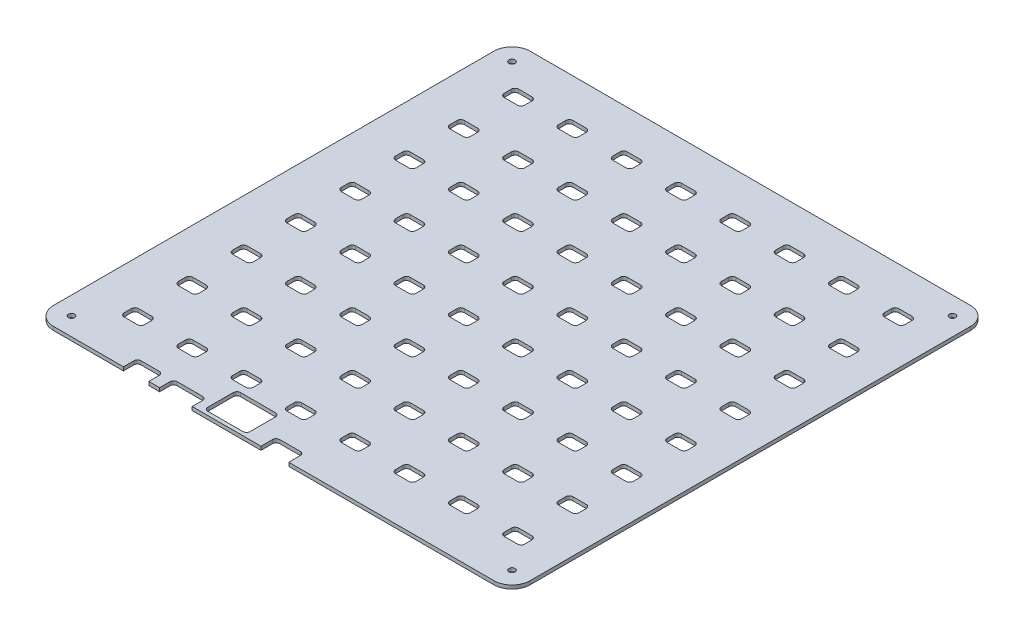
from build123d import *

# Parameters (mm, degrees)
SKETCH1_W           = 395
SKETCH1_H           = 395
SKETCH1_R           = 2.55
BOSS_EXTRUDE1_DEPTH = 3
FILLET1_R           = 15
SKETCH2_W           = 17
SKETCH2_H           = 12
CUT_EXTRUDE1_DEPTH  = 280.323289398
FILLET2_R           = 3
LPATTERN1_DEPTH     = 3
SKETCH3_W           = 21
SKETCH3_H           = 11.58800765
SKETCH3_W_2         = 27
SKETCH3_W_3         = 35
SKETCH3_H_2         = 27
SKETCH3_W_4         = 23
SKETCH3_H_3         = 12.540899571
CUT_EXTRUDE2_DEPTH  = 280.323289398
FILLET3_R           = 3


# Read off the part's stored shape, not the designer's step: LPattern1
with BuildPart() as part:
    # Sketch1 → Boss-Extrude1 (new body)
    with BuildSketch(Plane(origin=(0, 0, 0), x_dir=(1, 0, 0), z_dir=(0, 1, 0))):
        Rectangle(SKETCH1_W, SKETCH1_H)
        with Locations(Location((-182.5, 182.5, 0), (0, 0, 270))):
            Circle(SKETCH1_R, mode=Mode.SUBTRACT)
        with Locations(Location((182.5, 182.5, 0), (0, 0, 270))):
            Circle(SKETCH1_R, mode=Mode.SUBTRACT)
        with Locations(Location((182.5, -182.5, 0), (0, 0, 270))):
            Circle(SKETCH1_R, mode=Mode.SUBTRACT)
        with Locations(Location((-182.5, -182.5, 0), (0, 0, 270))):
            Circle(SKETCH1_R, mode=Mode.SUBTRACT)
    extrude(amount=BOSS_EXTRUDE1_DEPTH)

    # Fillet1
    fillet1_edges = [part.edges().sort_by_distance(p)[0] for p in [
        (197.5, 1.5, 197.5),
        (-197.5, 1.5, 197.5),
        (-197.5, 1.5, -197.5),
        (197.5, 1.5, -197.5),
    ]]
    fillet(fillet1_edges, radius=FILLET1_R)

    # Sketch2 → Cut-Extrude1 (cut, through all)
    with BuildSketch(Plane(origin=(0, 3, 0), x_dir=(1, 0, 0), z_dir=(0, 1, 0))):
        with Locations((-154.5, -155.5)):
            Rectangle(SKETCH2_W, SKETCH2_H)
    extrude(amount=-CUT_EXTRUDE1_DEPTH, mode=Mode.SUBTRACT)

    # Fillet2
    fillet2_edges = [part.edges().sort_by_distance(p)[0] for p in [
        (-146, 1.5, 149.5),
        (-146, 1.5, 161.5),
        (-163, 1.5, 161.5),
        (-163, 1.5, 149.5),
    ]]
    fillet(fillet2_edges, radius=FILLET2_R)

    # LPattern1 outline → LPattern1 (cut)
    with BuildSketch(Plane(origin=(0, 0, 0), x_dir=(1, 0, 0), z_dir=(0, 1, 0))):
        with BuildLine():
            ThreePointArc((155, 165.5), (152.878679656, 164.621320344), (152, 162.5))
            Line((152, 162.5), (152, 156.5))
            ThreePointArc((152, 156.5), (152.878679656, 154.378679656), (155, 153.5))
            Line((155, 153.5), (166, 153.5))
            ThreePointArc((166, 153.5), (168.121320344, 154.378679656), (169, 156.5))
            Line((169, 156.5), (169, 162.5))
            ThreePointArc((169, 162.5), (168.121320344, 164.621320344), (166, 165.5))
            Line((166, 165.5), (155, 165.5))
        make_face()
        with BuildLine():
            ThreePointArc((124, 162.5), (123.121320344, 164.621320344), (121, 165.5))
            Line((121, 165.5), (110, 165.5))
            ThreePointArc((110, 165.5), (107.878679656, 164.621320344), (107, 162.5))
            Line((107, 162.5), (107, 156.5))
            ThreePointArc((107, 156.5), (107.878679656, 154.378679656), (110, 153.5))
            Line((110, 153.5), (121, 153.5))
            ThreePointArc((121, 153.5), (123.121320344, 154.378679656), (124, 156.5))
            Line((124, 156.5), (124, 162.5))
        make_face()
        with BuildLine():
            ThreePointArc((79, 162.5), (78.121320344, 164.621320344), (76, 165.5))
            Line((76, 165.5), (65, 165.5))
            ThreePointArc((65, 165.5), (62.878679656, 164.621320344), (62, 162.5))
            Line((62, 162.5), (62, 156.5))
            ThreePointArc((62, 156.5), (62.878679656, 154.378679656), (65, 153.5))
            Line((65, 153.5), (76, 153.5))
            ThreePointArc((76, 153.5), (78.121320344, 154.378679656), (79, 156.5))
            Line((79, 156.5), (79, 162.5))
        make_face()
        with BuildLine():
            ThreePointArc((34, 162.5), (33.121320344, 164.621320344), (31, 165.5))
            Line((31, 165.5), (20, 165.5))
            ThreePointArc((20, 165.5), (17.878679656, 164.621320344), (17, 162.5))
            Line((17, 162.5), (17, 156.5))
            ThreePointArc((17, 156.5), (17.878679656, 154.378679656), (20, 153.5))
            Line((20, 153.5), (31, 153.5))
            ThreePointArc((31, 153.5), (33.121320344, 154.378679656), (34, 156.5))
            Line((34, 156.5), (34, 162.5))
        make_face()
        with BuildLine():
            ThreePointArc((-11, 162.5), (-11.878679656, 164.621320344), (-14, 165.5))
            Line((-14, 165.5), (-25, 165.5))
            ThreePointArc((-25, 165.5), (-27.121320344, 164.621320344), (-28, 162.5))
            Line((-28, 162.5), (-28, 156.5))
            ThreePointArc((-28, 156.5), (-27.121320344, 154.378679656), (-25, 153.5))
            Line((-25, 153.5), (-14, 153.5))
            ThreePointArc((-14, 153.5), (-11.878679656, 154.378679656), (-11, 156.5))
            Line((-11, 156.5), (-11, 162.5))
        make_face()
        with BuildLine():
            ThreePointArc((-56, 162.5), (-56.878679656, 164.621320344), (-59, 165.5))
            Line((-59, 165.5), (-70, 165.5))
            ThreePointArc((-70, 165.5), (-72.121320344, 164.621320344), (-73, 162.5))
            Line((-73, 162.5), (-73, 156.5))
            ThreePointArc((-73, 156.5), (-72.121320344, 154.378679656), (-70, 153.5))
            Line((-70, 153.5), (-59, 153.5))
            ThreePointArc((-59, 153.5), (-56.878679656, 154.378679656), (-56, 156.5))
            Line((-56, 156.5), (-56, 162.5))
        make_face()
        with BuildLine():
            ThreePointArc((-101, 162.5), (-101.878679656, 164.621320344), (-104, 165.5))
            Line((-104, 165.5), (-115, 165.5))
            ThreePointArc((-115, 165.5), (-117.121320344, 164.621320344), (-118, 162.5))
            Line((-118, 162.5), (-118, 156.5))
            ThreePointArc((-118, 156.5), (-117.121320344, 154.378679656), (-115, 153.5))
            Line((-115, 153.5), (-104, 153.5))
            ThreePointArc((-104, 153.5), (-101.878679656, 154.378679656), (-101, 156.5))
            Line((-101, 156.5), (-101, 162.5))
        make_face()
        with BuildLine():
            ThreePointArc((-146, 162.5), (-146.878679656, 164.621320344), (-149, 165.5))
            Line((-149, 165.5), (-160, 165.5))
            ThreePointArc((-160, 165.5), (-162.121320344, 164.621320344), (-163, 162.5))
            Line((-163, 162.5), (-163, 156.5))
            ThreePointArc((-163, 156.5), (-162.121320344, 154.378679656), (-160, 153.5))
            Line((-160, 153.5), (-149, 153.5))
            ThreePointArc((-149, 153.5), (-146.878679656, 154.378679656), (-146, 156.5))
            Line((-146, 156.5), (-146, 162.5))
        make_face()
        with BuildLine():
            ThreePointArc((166, 108.5), (168.121320344, 109.378679656), (169, 111.5))
            Line((169, 111.5), (169, 117.5))
            ThreePointArc((169, 117.5), (168.121320344, 119.621320344), (166, 120.5))
            Line((166, 120.5), (155, 120.5))
            ThreePointArc((155, 120.5), (152.878679656, 119.621320344), (152, 117.5))
            Line((152, 117.5), (152, 111.5))
            ThreePointArc((152, 111.5), (152.878679656, 109.378679656), (155, 108.5))
            Line((155, 108.5), (166, 108.5))
        make_face()
        with BuildLine():
            ThreePointArc((166, 63.5), (168.121320344, 64.378679656), (169, 66.5))
            Line((169, 66.5), (169, 72.5))
            ThreePointArc((169, 72.5), (168.121320344, 74.621320344), (166, 75.5))
            Line((166, 75.5), (155, 75.5))
            ThreePointArc((155, 75.5), (152.878679656, 74.621320344), (152, 72.5))
            Line((152, 72.5), (152, 66.5))
            ThreePointArc((152, 66.5), (152.878679656, 64.378679656), (155, 63.5))
            Line((155, 63.5), (166, 63.5))
        make_face()
        with BuildLine():
            ThreePointArc((166, 18.5), (168.121320344, 19.378679656), (169, 21.5))
            Line((169, 21.5), (169, 27.5))
            ThreePointArc((169, 27.5), (168.121320344, 29.621320344), (166, 30.5))
            Line((166, 30.5), (155, 30.5))
            ThreePointArc((155, 30.5), (152.878679656, 29.621320344), (152, 27.5))
            Line((152, 27.5), (152, 21.5))
            ThreePointArc((152, 21.5), (152.878679656, 19.378679656), (155, 18.5))
            Line((155, 18.5), (166, 18.5))
        make_face()
        with BuildLine():
            ThreePointArc((166, -26.5), (168.121320344, -25.621320344), (169, -23.5))
            Line((169, -23.5), (169, -17.5))
            ThreePointArc((169, -17.5), (168.121320344, -15.378679656), (166, -14.5))
            Line((166, -14.5), (155, -14.5))
            ThreePointArc((155, -14.5), (152.878679656, -15.378679656), (152, -17.5))
            Line((152, -17.5), (152, -23.5))
            ThreePointArc((152, -23.5), (152.878679656, -25.621320344), (155, -26.5))
            Line((155, -26.5), (166, -26.5))
        make_face()
        with BuildLine():
            ThreePointArc((166, -71.5), (168.121320344, -70.621320344), (169, -68.5))
            Line((169, -68.5), (169, -62.5))
            ThreePointArc((169, -62.5), (168.121320344, -60.378679656), (166, -59.5))
            Line((166, -59.5), (155, -59.5))
            ThreePointArc((155, -59.5), (152.878679656, -60.378679656), (152, -62.5))
            Line((152, -62.5), (152, -68.5))
            ThreePointArc((152, -68.5), (152.878679656, -70.621320344), (155, -71.5))
            Line((155, -71.5), (166, -71.5))
        make_face()
        with BuildLine():
            ThreePointArc((166, -116.5), (168.121320344, -115.621320344), (169, -113.5))
            Line((169, -113.5), (169, -107.5))
            ThreePointArc((169, -107.5), (168.121320344, -105.378679656), (166, -104.5))
            Line((166, -104.5), (155, -104.5))
            ThreePointArc((155, -104.5), (152.878679656, -105.378679656), (152, -107.5))
            Line((152, -107.5), (152, -113.5))
            ThreePointArc((152, -113.5), (152.878679656, -115.621320344), (155, -116.5))
            Line((155, -116.5), (166, -116.5))
        make_face()
        with BuildLine():
            ThreePointArc((166, -161.5), (168.121320344, -160.621320344), (169, -158.5))
            Line((169, -158.5), (169, -152.5))
            ThreePointArc((169, -152.5), (168.121320344, -150.378679656), (166, -149.5))
            Line((166, -149.5), (155, -149.5))
            ThreePointArc((155, -149.5), (152.878679656, -150.378679656), (152, -152.5))
            Line((152, -152.5), (152, -158.5))
            ThreePointArc((152, -158.5), (152.878679656, -160.621320344), (155, -161.5))
            Line((155, -161.5), (166, -161.5))
        make_face()
        with BuildLine():
            ThreePointArc((124, 117.5), (123.121320344, 119.621320344), (121, 120.5))
            Line((121, 120.5), (110, 120.5))
            ThreePointArc((110, 120.5), (107.878679656, 119.621320344), (107, 117.5))
            Line((107, 117.5), (107, 111.5))
            ThreePointArc((107, 111.5), (107.878679656, 109.378679656), (110, 108.5))
            Line((110, 108.5), (121, 108.5))
            ThreePointArc((121, 108.5), (123.121320344, 109.378679656), (124, 111.5))
            Line((124, 111.5), (124, 117.5))
        make_face()
        with BuildLine():
            ThreePointArc((79, 117.5), (78.121320344, 119.621320344), (76, 120.5))
            Line((76, 120.5), (65, 120.5))
            ThreePointArc((65, 120.5), (62.878679656, 119.621320344), (62, 117.5))
            Line((62, 117.5), (62, 111.5))
            ThreePointArc((62, 111.5), (62.878679656, 109.378679656), (65, 108.5))
            Line((65, 108.5), (76, 108.5))
            ThreePointArc((76, 108.5), (78.121320344, 109.378679656), (79, 111.5))
            Line((79, 111.5), (79, 117.5))
        make_face()
        with BuildLine():
            ThreePointArc((34, 117.5), (33.121320344, 119.621320344), (31, 120.5))
            Line((31, 120.5), (20, 120.5))
            ThreePointArc((20, 120.5), (17.878679656, 119.621320344), (17, 117.5))
            Line((17, 117.5), (17, 111.5))
            ThreePointArc((17, 111.5), (17.878679656, 109.378679656), (20, 108.5))
            Line((20, 108.5), (31, 108.5))
            ThreePointArc((31, 108.5), (33.121320344, 109.378679656), (34, 111.5))
            Line((34, 111.5), (34, 117.5))
        make_face()
        with BuildLine():
            ThreePointArc((-11, 117.5), (-11.878679656, 119.621320344), (-14, 120.5))
            Line((-14, 120.5), (-25, 120.5))
            ThreePointArc((-25, 120.5), (-27.121320344, 119.621320344), (-28, 117.5))
            Line((-28, 117.5), (-28, 111.5))
            ThreePointArc((-28, 111.5), (-27.121320344, 109.378679656), (-25, 108.5))
            Line((-25, 108.5), (-14, 108.5))
            ThreePointArc((-14, 108.5), (-11.878679656, 109.378679656), (-11, 111.5))
            Line((-11, 111.5), (-11, 117.5))
        make_face()
        with BuildLine():
            ThreePointArc((-56, 117.5), (-56.878679656, 119.621320344), (-59, 120.5))
            Line((-59, 120.5), (-70, 120.5))
            ThreePointArc((-70, 120.5), (-72.121320344, 119.621320344), (-73, 117.5))
            Line((-73, 117.5), (-73, 111.5))
            ThreePointArc((-73, 111.5), (-72.121320344, 109.378679656), (-70, 108.5))
            Line((-70, 108.5), (-59, 108.5))
            ThreePointArc((-59, 108.5), (-56.878679656, 109.378679656), (-56, 111.5))
            Line((-56, 111.5), (-56, 117.5))
        make_face()
        with BuildLine():
            ThreePointArc((-101, 117.5), (-101.878679656, 119.621320344), (-104, 120.5))
            Line((-104, 120.5), (-115, 120.5))
            ThreePointArc((-115, 120.5), (-117.121320344, 119.621320344), (-118, 117.5))
            Line((-118, 117.5), (-118, 111.5))
            ThreePointArc((-118, 111.5), (-117.121320344, 109.378679656), (-115, 108.5))
            Line((-115, 108.5), (-104, 108.5))
            ThreePointArc((-104, 108.5), (-101.878679656, 109.378679656), (-101, 111.5))
            Line((-101, 111.5), (-101, 117.5))
        make_face()
        with BuildLine():
            ThreePointArc((-146, 117.5), (-146.878679656, 119.621320344), (-149, 120.5))
            Line((-149, 120.5), (-160, 120.5))
            ThreePointArc((-160, 120.5), (-162.121320344, 119.621320344), (-163, 117.5))
            Line((-163, 117.5), (-163, 111.5))
            ThreePointArc((-163, 111.5), (-162.121320344, 109.378679656), (-160, 108.5))
            Line((-160, 108.5), (-149, 108.5))
            ThreePointArc((-149, 108.5), (-146.878679656, 109.378679656), (-146, 111.5))
            Line((-146, 111.5), (-146, 117.5))
        make_face()
        with BuildLine():
            ThreePointArc((124, 72.5), (123.121320344, 74.621320344), (121, 75.5))
            Line((121, 75.5), (110, 75.5))
            ThreePointArc((110, 75.5), (107.878679656, 74.621320344), (107, 72.5))
            Line((107, 72.5), (107, 66.5))
            ThreePointArc((107, 66.5), (107.878679656, 64.378679656), (110, 63.5))
            Line((110, 63.5), (121, 63.5))
            ThreePointArc((121, 63.5), (123.121320344, 64.378679656), (124, 66.5))
            Line((124, 66.5), (124, 72.5))
        make_face()
        with BuildLine():
            ThreePointArc((79, 72.5), (78.121320344, 74.621320344), (76, 75.5))
            Line((76, 75.5), (65, 75.5))
            ThreePointArc((65, 75.5), (62.878679656, 74.621320344), (62, 72.5))
            Line((62, 72.5), (62, 66.5))
            ThreePointArc((62, 66.5), (62.878679656, 64.378679656), (65, 63.5))
            Line((65, 63.5), (76, 63.5))
            ThreePointArc((76, 63.5), (78.121320344, 64.378679656), (79, 66.5))
            Line((79, 66.5), (79, 72.5))
        make_face()
        with BuildLine():
            ThreePointArc((34, 72.5), (33.121320344, 74.621320344), (31, 75.5))
            Line((31, 75.5), (20, 75.5))
            ThreePointArc((20, 75.5), (17.878679656, 74.621320344), (17, 72.5))
            Line((17, 72.5), (17, 66.5))
            ThreePointArc((17, 66.5), (17.878679656, 64.378679656), (20, 63.5))
            Line((20, 63.5), (31, 63.5))
            ThreePointArc((31, 63.5), (33.121320344, 64.378679656), (34, 66.5))
            Line((34, 66.5), (34, 72.5))
        make_face()
        with BuildLine():
            ThreePointArc((-11, 72.5), (-11.878679656, 74.621320344), (-14, 75.5))
            Line((-14, 75.5), (-25, 75.5))
            ThreePointArc((-25, 75.5), (-27.121320344, 74.621320344), (-28, 72.5))
            Line((-28, 72.5), (-28, 66.5))
            ThreePointArc((-28, 66.5), (-27.121320344, 64.378679656), (-25, 63.5))
            Line((-25, 63.5), (-14, 63.5))
            ThreePointArc((-14, 63.5), (-11.878679656, 64.378679656), (-11, 66.5))
            Line((-11, 66.5), (-11, 72.5))
        make_face()
        with BuildLine():
            ThreePointArc((-56, 72.5), (-56.878679656, 74.621320344), (-59, 75.5))
            Line((-59, 75.5), (-70, 75.5))
            ThreePointArc((-70, 75.5), (-72.121320344, 74.621320344), (-73, 72.5))
            Line((-73, 72.5), (-73, 66.5))
            ThreePointArc((-73, 66.5), (-72.121320344, 64.378679656), (-70, 63.5))
            Line((-70, 63.5), (-59, 63.5))
            ThreePointArc((-59, 63.5), (-56.878679656, 64.378679656), (-56, 66.5))
            Line((-56, 66.5), (-56, 72.5))
        make_face()
        with BuildLine():
            ThreePointArc((-101, 72.5), (-101.878679656, 74.621320344), (-104, 75.5))
            Line((-104, 75.5), (-115, 75.5))
            ThreePointArc((-115, 75.5), (-117.121320344, 74.621320344), (-118, 72.5))
            Line((-118, 72.5), (-118, 66.5))
            ThreePointArc((-118, 66.5), (-117.121320344, 64.378679656), (-115, 63.5))
            Line((-115, 63.5), (-104, 63.5))
            ThreePointArc((-104, 63.5), (-101.878679656, 64.378679656), (-101, 66.5))
            Line((-101, 66.5), (-101, 72.5))
        make_face()
        with BuildLine():
            ThreePointArc((-146, 72.5), (-146.878679656, 74.621320344), (-149, 75.5))
            Line((-149, 75.5), (-160, 75.5))
            ThreePointArc((-160, 75.5), (-162.121320344, 74.621320344), (-163, 72.5))
            Line((-163, 72.5), (-163, 66.5))
            ThreePointArc((-163, 66.5), (-162.121320344, 64.378679656), (-160, 63.5))
            Line((-160, 63.5), (-149, 63.5))
            ThreePointArc((-149, 63.5), (-146.878679656, 64.378679656), (-146, 66.5))
            Line((-146, 66.5), (-146, 72.5))
        make_face()
        with BuildLine():
            ThreePointArc((124, 27.5), (123.121320344, 29.621320344), (121, 30.5))
            Line((121, 30.5), (110, 30.5))
            ThreePointArc((110, 30.5), (107.878679656, 29.621320344), (107, 27.5))
            Line((107, 27.5), (107, 21.5))
            ThreePointArc((107, 21.5), (107.878679656, 19.378679656), (110, 18.5))
            Line((110, 18.5), (121, 18.5))
            ThreePointArc((121, 18.5), (123.121320344, 19.378679656), (124, 21.5))
            Line((124, 21.5), (124, 27.5))
        make_face()
        with BuildLine():
            ThreePointArc((79, 27.5), (78.121320344, 29.621320344), (76, 30.5))
            Line((76, 30.5), (65, 30.5))
            ThreePointArc((65, 30.5), (62.878679656, 29.621320344), (62, 27.5))
            Line((62, 27.5), (62, 21.5))
            ThreePointArc((62, 21.5), (62.878679656, 19.378679656), (65, 18.5))
            Line((65, 18.5), (76, 18.5))
            ThreePointArc((76, 18.5), (78.121320344, 19.378679656), (79, 21.5))
            Line((79, 21.5), (79, 27.5))
        make_face()
        with BuildLine():
            ThreePointArc((34, 27.5), (33.121320344, 29.621320344), (31, 30.5))
            Line((31, 30.5), (20, 30.5))
            ThreePointArc((20, 30.5), (17.878679656, 29.621320344), (17, 27.5))
            Line((17, 27.5), (17, 21.5))
            ThreePointArc((17, 21.5), (17.878679656, 19.378679656), (20, 18.5))
            Line((20, 18.5), (31, 18.5))
            ThreePointArc((31, 18.5), (33.121320344, 19.378679656), (34, 21.5))
            Line((34, 21.5), (34, 27.5))
        make_face()
        with BuildLine():
            ThreePointArc((-11, 27.5), (-11.878679656, 29.621320344), (-14, 30.5))
            Line((-14, 30.5), (-25, 30.5))
            ThreePointArc((-25, 30.5), (-27.121320344, 29.621320344), (-28, 27.5))
            Line((-28, 27.5), (-28, 21.5))
            ThreePointArc((-28, 21.5), (-27.121320344, 19.378679656), (-25, 18.5))
            Line((-25, 18.5), (-14, 18.5))
            ThreePointArc((-14, 18.5), (-11.878679656, 19.378679656), (-11, 21.5))
            Line((-11, 21.5), (-11, 27.5))
        make_face()
        with BuildLine():
            ThreePointArc((-56, 27.5), (-56.878679656, 29.621320344), (-59, 30.5))
            Line((-59, 30.5), (-70, 30.5))
            ThreePointArc((-70, 30.5), (-72.121320344, 29.621320344), (-73, 27.5))
            Line((-73, 27.5), (-73, 21.5))
            ThreePointArc((-73, 21.5), (-72.121320344, 19.378679656), (-70, 18.5))
            Line((-70, 18.5), (-59, 18.5))
            ThreePointArc((-59, 18.5), (-56.878679656, 19.378679656), (-56, 21.5))
            Line((-56, 21.5), (-56, 27.5))
        make_face()
        with BuildLine():
            ThreePointArc((-101, 27.5), (-101.878679656, 29.621320344), (-104, 30.5))
            Line((-104, 30.5), (-115, 30.5))
            ThreePointArc((-115, 30.5), (-117.121320344, 29.621320344), (-118, 27.5))
            Line((-118, 27.5), (-118, 21.5))
            ThreePointArc((-118, 21.5), (-117.121320344, 19.378679656), (-115, 18.5))
            Line((-115, 18.5), (-104, 18.5))
            ThreePointArc((-104, 18.5), (-101.878679656, 19.378679656), (-101, 21.5))
            Line((-101, 21.5), (-101, 27.5))
        make_face()
        with BuildLine():
            ThreePointArc((-146, 27.5), (-146.878679656, 29.621320344), (-149, 30.5))
            Line((-149, 30.5), (-160, 30.5))
            ThreePointArc((-160, 30.5), (-162.121320344, 29.621320344), (-163, 27.5))
            Line((-163, 27.5), (-163, 21.5))
            ThreePointArc((-163, 21.5), (-162.121320344, 19.378679656), (-160, 18.5))
            Line((-160, 18.5), (-149, 18.5))
            ThreePointArc((-149, 18.5), (-146.878679656, 19.378679656), (-146, 21.5))
            Line((-146, 21.5), (-146, 27.5))
        make_face()
        with BuildLine():
            ThreePointArc((124, -17.5), (123.121320344, -15.378679656), (121, -14.5))
            Line((121, -14.5), (110, -14.5))
            ThreePointArc((110, -14.5), (107.878679656, -15.378679656), (107, -17.5))
            Line((107, -17.5), (107, -23.5))
            ThreePointArc((107, -23.5), (107.878679656, -25.621320344), (110, -26.5))
            Line((110, -26.5), (121, -26.5))
            ThreePointArc((121, -26.5), (123.121320344, -25.621320344), (124, -23.5))
            Line((124, -23.5), (124, -17.5))
        make_face()
        with BuildLine():
            ThreePointArc((79, -17.5), (78.121320344, -15.378679656), (76, -14.5))
            Line((76, -14.5), (65, -14.5))
            ThreePointArc((65, -14.5), (62.878679656, -15.378679656), (62, -17.5))
            Line((62, -17.5), (62, -23.5))
            ThreePointArc((62, -23.5), (62.878679656, -25.621320344), (65, -26.5))
            Line((65, -26.5), (76, -26.5))
            ThreePointArc((76, -26.5), (78.121320344, -25.621320344), (79, -23.5))
            Line((79, -23.5), (79, -17.5))
        make_face()
        with BuildLine():
            ThreePointArc((34, -17.5), (33.121320344, -15.378679656), (31, -14.5))
            Line((31, -14.5), (20, -14.5))
            ThreePointArc((20, -14.5), (17.878679656, -15.378679656), (17, -17.5))
            Line((17, -17.5), (17, -23.5))
            ThreePointArc((17, -23.5), (17.878679656, -25.621320344), (20, -26.5))
            Line((20, -26.5), (31, -26.5))
            ThreePointArc((31, -26.5), (33.121320344, -25.621320344), (34, -23.5))
            Line((34, -23.5), (34, -17.5))
        make_face()
        with BuildLine():
            ThreePointArc((-11, -17.5), (-11.878679656, -15.378679656), (-14, -14.5))
            Line((-14, -14.5), (-25, -14.5))
            ThreePointArc((-25, -14.5), (-27.121320344, -15.378679656), (-28, -17.5))
            Line((-28, -17.5), (-28, -23.5))
            ThreePointArc((-28, -23.5), (-27.121320344, -25.621320344), (-25, -26.5))
            Line((-25, -26.5), (-14, -26.5))
            ThreePointArc((-14, -26.5), (-11.878679656, -25.621320344), (-11, -23.5))
            Line((-11, -23.5), (-11, -17.5))
        make_face()
        with BuildLine():
            ThreePointArc((-56, -17.5), (-56.878679656, -15.378679656), (-59, -14.5))
            Line((-59, -14.5), (-70, -14.5))
            ThreePointArc((-70, -14.5), (-72.121320344, -15.378679656), (-73, -17.5))
            Line((-73, -17.5), (-73, -23.5))
            ThreePointArc((-73, -23.5), (-72.121320344, -25.621320344), (-70, -26.5))
            Line((-70, -26.5), (-59, -26.5))
            ThreePointArc((-59, -26.5), (-56.878679656, -25.621320344), (-56, -23.5))
            Line((-56, -23.5), (-56, -17.5))
        make_face()
        with BuildLine():
            ThreePointArc((-101, -17.5), (-101.878679656, -15.378679656), (-104, -14.5))
            Line((-104, -14.5), (-115, -14.5))
            ThreePointArc((-115, -14.5), (-117.121320344, -15.378679656), (-118, -17.5))
            Line((-118, -17.5), (-118, -23.5))
            ThreePointArc((-118, -23.5), (-117.121320344, -25.621320344), (-115, -26.5))
            Line((-115, -26.5), (-104, -26.5))
            ThreePointArc((-104, -26.5), (-101.878679656, -25.621320344), (-101, -23.5))
            Line((-101, -23.5), (-101, -17.5))
        make_face()
        with BuildLine():
            ThreePointArc((-146, -17.5), (-146.878679656, -15.378679656), (-149, -14.5))
            Line((-149, -14.5), (-160, -14.5))
            ThreePointArc((-160, -14.5), (-162.121320344, -15.378679656), (-163, -17.5))
            Line((-163, -17.5), (-163, -23.5))
            ThreePointArc((-163, -23.5), (-162.121320344, -25.621320344), (-160, -26.5))
            Line((-160, -26.5), (-149, -26.5))
            ThreePointArc((-149, -26.5), (-146.878679656, -25.621320344), (-146, -23.5))
            Line((-146, -23.5), (-146, -17.5))
        make_face()
        with BuildLine():
            ThreePointArc((124, -62.5), (123.121320344, -60.378679656), (121, -59.5))
            Line((121, -59.5), (110, -59.5))
            ThreePointArc((110, -59.5), (107.878679656, -60.378679656), (107, -62.5))
            Line((107, -62.5), (107, -68.5))
            ThreePointArc((107, -68.5), (107.878679656, -70.621320344), (110, -71.5))
            Line((110, -71.5), (121, -71.5))
            ThreePointArc((121, -71.5), (123.121320344, -70.621320344), (124, -68.5))
            Line((124, -68.5), (124, -62.5))
        make_face()
        with BuildLine():
            ThreePointArc((79, -62.5), (78.121320344, -60.378679656), (76, -59.5))
            Line((76, -59.5), (65, -59.5))
            ThreePointArc((65, -59.5), (62.878679656, -60.378679656), (62, -62.5))
            Line((62, -62.5), (62, -68.5))
            ThreePointArc((62, -68.5), (62.878679656, -70.621320344), (65, -71.5))
            Line((65, -71.5), (76, -71.5))
            ThreePointArc((76, -71.5), (78.121320344, -70.621320344), (79, -68.5))
            Line((79, -68.5), (79, -62.5))
        make_face()
        with BuildLine():
            ThreePointArc((34, -62.5), (33.121320344, -60.378679656), (31, -59.5))
            Line((31, -59.5), (20, -59.5))
            ThreePointArc((20, -59.5), (17.878679656, -60.378679656), (17, -62.5))
            Line((17, -62.5), (17, -68.5))
            ThreePointArc((17, -68.5), (17.878679656, -70.621320344), (20, -71.5))
            Line((20, -71.5), (31, -71.5))
            ThreePointArc((31, -71.5), (33.121320344, -70.621320344), (34, -68.5))
            Line((34, -68.5), (34, -62.5))
        make_face()
        with BuildLine():
            ThreePointArc((-11, -62.5), (-11.878679656, -60.378679656), (-14, -59.5))
            Line((-14, -59.5), (-25, -59.5))
            ThreePointArc((-25, -59.5), (-27.121320344, -60.378679656), (-28, -62.5))
            Line((-28, -62.5), (-28, -68.5))
            ThreePointArc((-28, -68.5), (-27.121320344, -70.621320344), (-25, -71.5))
            Line((-25, -71.5), (-14, -71.5))
            ThreePointArc((-14, -71.5), (-11.878679656, -70.621320344), (-11, -68.5))
            Line((-11, -68.5), (-11, -62.5))
        make_face()
        with BuildLine():
            ThreePointArc((-56, -62.5), (-56.878679656, -60.378679656), (-59, -59.5))
            Line((-59, -59.5), (-70, -59.5))
            ThreePointArc((-70, -59.5), (-72.121320344, -60.378679656), (-73, -62.5))
            Line((-73, -62.5), (-73, -68.5))
            ThreePointArc((-73, -68.5), (-72.121320344, -70.621320344), (-70, -71.5))
            Line((-70, -71.5), (-59, -71.5))
            ThreePointArc((-59, -71.5), (-56.878679656, -70.621320344), (-56, -68.5))
            Line((-56, -68.5), (-56, -62.5))
        make_face()
        with BuildLine():
            ThreePointArc((-101, -62.5), (-101.878679656, -60.378679656), (-104, -59.5))
            Line((-104, -59.5), (-115, -59.5))
            ThreePointArc((-115, -59.5), (-117.121320344, -60.378679656), (-118, -62.5))
            Line((-118, -62.5), (-118, -68.5))
            ThreePointArc((-118, -68.5), (-117.121320344, -70.621320344), (-115, -71.5))
            Line((-115, -71.5), (-104, -71.5))
            ThreePointArc((-104, -71.5), (-101.878679656, -70.621320344), (-101, -68.5))
            Line((-101, -68.5), (-101, -62.5))
        make_face()
        with BuildLine():
            ThreePointArc((-146, -62.5), (-146.878679656, -60.378679656), (-149, -59.5))
            Line((-149, -59.5), (-160, -59.5))
            ThreePointArc((-160, -59.5), (-162.121320344, -60.378679656), (-163, -62.5))
            Line((-163, -62.5), (-163, -68.5))
            ThreePointArc((-163, -68.5), (-162.121320344, -70.621320344), (-160, -71.5))
            Line((-160, -71.5), (-149, -71.5))
            ThreePointArc((-149, -71.5), (-146.878679656, -70.621320344), (-146, -68.5))
            Line((-146, -68.5), (-146, -62.5))
        make_face()
        with BuildLine():
            ThreePointArc((124, -107.5), (123.121320344, -105.378679656), (121, -104.5))
            Line((121, -104.5), (110, -104.5))
            ThreePointArc((110, -104.5), (107.878679656, -105.378679656), (107, -107.5))
            Line((107, -107.5), (107, -113.5))
            ThreePointArc((107, -113.5), (107.878679656, -115.621320344), (110, -116.5))
            Line((110, -116.5), (121, -116.5))
            ThreePointArc((121, -116.5), (123.121320344, -115.621320344), (124, -113.5))
            Line((124, -113.5), (124, -107.5))
        make_face()
        with BuildLine():
            ThreePointArc((79, -107.5), (78.121320344, -105.378679656), (76, -104.5))
            Line((76, -104.5), (65, -104.5))
            ThreePointArc((65, -104.5), (62.878679656, -105.378679656), (62, -107.5))
            Line((62, -107.5), (62, -113.5))
            ThreePointArc((62, -113.5), (62.878679656, -115.621320344), (65, -116.5))
            Line((65, -116.5), (76, -116.5))
            ThreePointArc((76, -116.5), (78.121320344, -115.621320344), (79, -113.5))
            Line((79, -113.5), (79, -107.5))
        make_face()
        with BuildLine():
            ThreePointArc((34, -107.5), (33.121320344, -105.378679656), (31, -104.5))
            Line((31, -104.5), (20, -104.5))
            ThreePointArc((20, -104.5), (17.878679656, -105.378679656), (17, -107.5))
            Line((17, -107.5), (17, -113.5))
            ThreePointArc((17, -113.5), (17.878679656, -115.621320344), (20, -116.5))
            Line((20, -116.5), (31, -116.5))
            ThreePointArc((31, -116.5), (33.121320344, -115.621320344), (34, -113.5))
            Line((34, -113.5), (34, -107.5))
        make_face()
        with BuildLine():
            ThreePointArc((-11, -107.5), (-11.878679656, -105.378679656), (-14, -104.5))
            Line((-14, -104.5), (-25, -104.5))
            ThreePointArc((-25, -104.5), (-27.121320344, -105.378679656), (-28, -107.5))
            Line((-28, -107.5), (-28, -113.5))
            ThreePointArc((-28, -113.5), (-27.121320344, -115.621320344), (-25, -116.5))
            Line((-25, -116.5), (-14, -116.5))
            ThreePointArc((-14, -116.5), (-11.878679656, -115.621320344), (-11, -113.5))
            Line((-11, -113.5), (-11, -107.5))
        make_face()
        with BuildLine():
            ThreePointArc((-56, -107.5), (-56.878679656, -105.378679656), (-59, -104.5))
            Line((-59, -104.5), (-70, -104.5))
            ThreePointArc((-70, -104.5), (-72.121320344, -105.378679656), (-73, -107.5))
            Line((-73, -107.5), (-73, -113.5))
            ThreePointArc((-73, -113.5), (-72.121320344, -115.621320344), (-70, -116.5))
            Line((-70, -116.5), (-59, -116.5))
            ThreePointArc((-59, -116.5), (-56.878679656, -115.621320344), (-56, -113.5))
            Line((-56, -113.5), (-56, -107.5))
        make_face()
        with BuildLine():
            ThreePointArc((-101, -107.5), (-101.878679656, -105.378679656), (-104, -104.5))
            Line((-104, -104.5), (-115, -104.5))
            ThreePointArc((-115, -104.5), (-117.121320344, -105.378679656), (-118, -107.5))
            Line((-118, -107.5), (-118, -113.5))
            ThreePointArc((-118, -113.5), (-117.121320344, -115.621320344), (-115, -116.5))
            Line((-115, -116.5), (-104, -116.5))
            ThreePointArc((-104, -116.5), (-101.878679656, -115.621320344), (-101, -113.5))
            Line((-101, -113.5), (-101, -107.5))
        make_face()
        with BuildLine():
            ThreePointArc((-146, -107.5), (-146.878679656, -105.378679656), (-149, -104.5))
            Line((-149, -104.5), (-160, -104.5))
            ThreePointArc((-160, -104.5), (-162.121320344, -105.378679656), (-163, -107.5))
            Line((-163, -107.5), (-163, -113.5))
            ThreePointArc((-163, -113.5), (-162.121320344, -115.621320344), (-160, -116.5))
            Line((-160, -116.5), (-149, -116.5))
            ThreePointArc((-149, -116.5), (-146.878679656, -115.621320344), (-146, -113.5))
            Line((-146, -113.5), (-146, -107.5))
        make_face()
        with BuildLine():
            ThreePointArc((124, -152.5), (123.121320344, -150.378679656), (121, -149.5))
            Line((121, -149.5), (110, -149.5))
            ThreePointArc((110, -149.5), (107.878679656, -150.378679656), (107, -152.5))
            Line((107, -152.5), (107, -158.5))
            ThreePointArc((107, -158.5), (107.878679656, -160.621320344), (110, -161.5))
            Line((110, -161.5), (121, -161.5))
            ThreePointArc((121, -161.5), (123.121320344, -160.621320344), (124, -158.5))
            Line((124, -158.5), (124, -152.5))
        make_face()
        with BuildLine():
            ThreePointArc((79, -152.5), (78.121320344, -150.378679656), (76, -149.5))
            Line((76, -149.5), (65, -149.5))
            ThreePointArc((65, -149.5), (62.878679656, -150.378679656), (62, -152.5))
            Line((62, -152.5), (62, -158.5))
            ThreePointArc((62, -158.5), (62.878679656, -160.621320344), (65, -161.5))
            Line((65, -161.5), (76, -161.5))
            ThreePointArc((76, -161.5), (78.121320344, -160.621320344), (79, -158.5))
            Line((79, -158.5), (79, -152.5))
        make_face()
        with BuildLine():
            ThreePointArc((34, -152.5), (33.121320344, -150.378679656), (31, -149.5))
            Line((31, -149.5), (20, -149.5))
            ThreePointArc((20, -149.5), (17.878679656, -150.378679656), (17, -152.5))
            Line((17, -152.5), (17, -158.5))
            ThreePointArc((17, -158.5), (17.878679656, -160.621320344), (20, -161.5))
            Line((20, -161.5), (31, -161.5))
            ThreePointArc((31, -161.5), (33.121320344, -160.621320344), (34, -158.5))
            Line((34, -158.5), (34, -152.5))
        make_face()
        with BuildLine():
            ThreePointArc((-11, -152.5), (-11.878679656, -150.378679656), (-14, -149.5))
            Line((-14, -149.5), (-25, -149.5))
            ThreePointArc((-25, -149.5), (-27.121320344, -150.378679656), (-28, -152.5))
            Line((-28, -152.5), (-28, -158.5))
            ThreePointArc((-28, -158.5), (-27.121320344, -160.621320344), (-25, -161.5))
            Line((-25, -161.5), (-14, -161.5))
            ThreePointArc((-14, -161.5), (-11.878679656, -160.621320344), (-11, -158.5))
            Line((-11, -158.5), (-11, -152.5))
        make_face()
        with BuildLine():
            ThreePointArc((-56, -152.5), (-56.878679656, -150.378679656), (-59, -149.5))
            Line((-59, -149.5), (-70, -149.5))
            ThreePointArc((-70, -149.5), (-72.121320344, -150.378679656), (-73, -152.5))
            Line((-73, -152.5), (-73, -158.5))
            ThreePointArc((-73, -158.5), (-72.121320344, -160.621320344), (-70, -161.5))
            Line((-70, -161.5), (-59, -161.5))
            ThreePointArc((-59, -161.5), (-56.878679656, -160.621320344), (-56, -158.5))
            Line((-56, -158.5), (-56, -152.5))
        make_face()
        with BuildLine():
            ThreePointArc((-101, -152.5), (-101.878679656, -150.378679656), (-104, -149.5))
            Line((-104, -149.5), (-115, -149.5))
            ThreePointArc((-115, -149.5), (-117.121320344, -150.378679656), (-118, -152.5))
            Line((-118, -152.5), (-118, -158.5))
            ThreePointArc((-118, -158.5), (-117.121320344, -160.621320344), (-115, -161.5))
            Line((-115, -161.5), (-104, -161.5))
            ThreePointArc((-104, -161.5), (-101.878679656, -160.621320344), (-101, -158.5))
            Line((-101, -158.5), (-101, -152.5))
        make_face()
    extrude(amount=LPATTERN1_DEPTH, mode=Mode.SUBTRACT)

    # Sketch3 → Cut-Extrude2 (cut, through all)
    with BuildSketch(Plane(origin=(0, 3, 0), x_dir=(1, 0, 0), z_dir=(0, 1, 0))):
        with Locations((-114, -191.705996175)):
            Rectangle(SKETCH3_W, SKETCH3_H)
        with Locations((-81, -191.705996175)):
            Rectangle(SKETCH3_W_2, SKETCH3_H)
        with Locations((-43, -181)):
            Rectangle(SKETCH3_W_3, SKETCH3_H_2)
        with Locations((1, -191.229550215)):
            Rectangle(SKETCH3_W_4, SKETCH3_H_3)
    extrude(amount=-CUT_EXTRUDE2_DEPTH, mode=Mode.SUBTRACT)

    # Fillet3
    fillet3_edges = [part.edges().sort_by_distance(p)[0] for p in [
        (-124.5, 1.5, 185.91199235),
        (-103.5, 1.5, 185.91199235),
        (-94.5, 1.5, 185.91199235),
        (-67.5, 1.5, 185.91199235),
        (-60.5, 1.5, 194.5),
        (-60.5, 1.5, 167.5),
        (-25.5, 1.5, 167.5),
        (-25.5, 1.5, 194.5),
        (-10.5, 1.5, 184.959100429),
        (12.5, 1.5, 184.959100429),
    ]]
    fillet(fillet3_edges, radius=FILLET3_R)


solid = part.part
